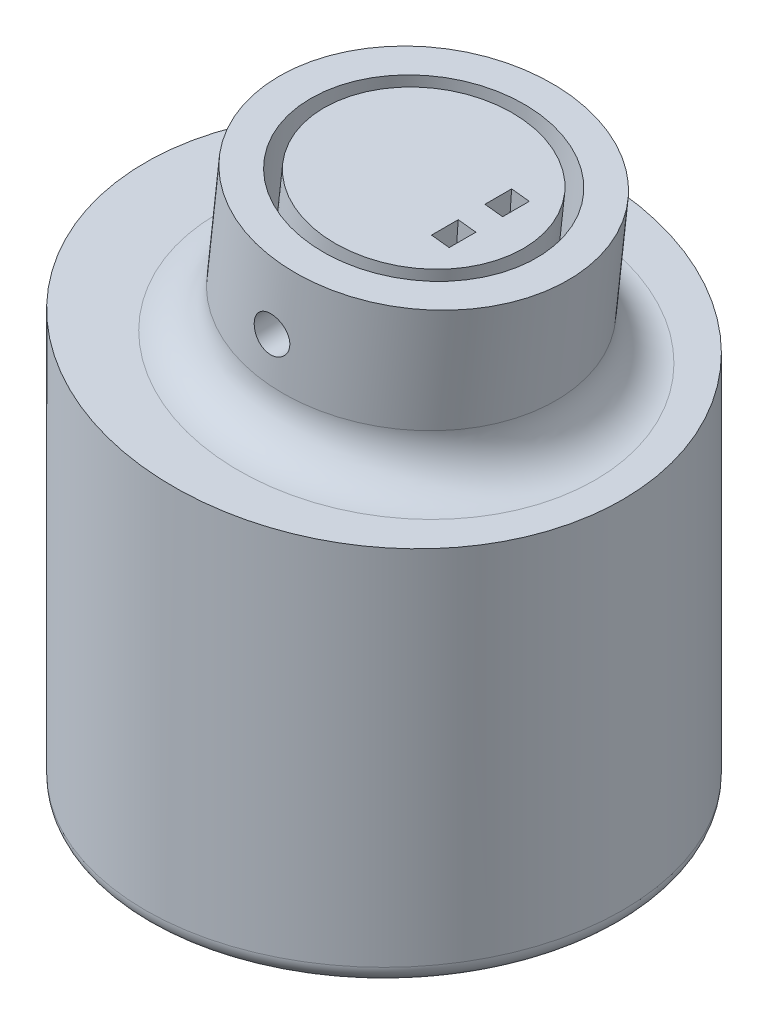
from build123d import *

# Parameters (mm, degrees)
SKETCH1_R                  = 26.8
MAIN_BODY_EXTRUDE_DEPTH    = 41.945
ANGLED_EXTRUDE_OUTLINE_R   = 26.8
ANGLED_EXTRUDE_DEPTH       = 6.012203303
ANGLED_START               = 44.670962752
ANGLED_EXTRUDE_2_OUTLINE_W = 56
ANGLED_EXTRUDE_2_OUTLINE_H = 56
ANGLED_EXTRUDE_2_DEPTH     = 7.329037248
SKETCH8_R                  = 16.325
ATTACHMENT_EXTRUDE_DEPTH   = 22.5
SKETCH11_R                 = 12.7625
SKETCH11_R_2               = 11.2625
TUBING_HOLE_DEPTH          = 45
SKETCH13_R                 = 2
BOLT_HOLE_DEPTH            = 25
SKETCH14_W                 = 34.35
SKETCH14_H                 = 34.35
CUT_EXTRUDE3_DEPTH         = 4
CUT_EXTRUDE4_DEPTH         = 2
SKETCH16_W                 = 23.74
SKETCH16_H                 = 28.35
CUT_EXTRUDE5_DEPTH         = 3.5
CUT_EXTRUDE12_REACH        = 74.294
SKETCH36_W                 = 2
SKETCH36_H                 = 3
FILLET3_R                  = 5
SKETCH32_R                 = 17.343535691
CUT_EXTRUDE10_DEPTH        = 5


with BuildPart() as part:
    # Sketch1 → Main Body Extrude (new body)
    with BuildSketch(Plane(origin=(0, 0, 0), x_dir=(1, 0, 0), z_dir=(0, 1, 0))):
        with Locations(Location((0, 0, 0), (0, 0, 270))):
            Circle(SKETCH1_R)
    extrude(amount=MAIN_BODY_EXTRUDE_DEPTH)

    # Angled Extrude: read off the stored shape, not the designer's step
    # Angled Extrude outline → Angled Extrude (add)
    with BuildSketch(Plane(origin=(0, 41.945, 0), x_dir=(1, 0, 0), z_dir=(0, 1, 0))):
        Circle(ANGLED_EXTRUDE_OUTLINE_R)
    extrude(amount=ANGLED_EXTRUDE_DEPTH)

    # Angled Extrude 2 outline → Angled Extrude 2 (cut)
    with BuildSketch(Plane(origin=(0, 0, 0), x_dir=(0.9937679191605965, -0.11146893220632507, 0), z_dir=(0.11146893220632506, 0.9937679191605965, 0)).offset(ANGLED_START)):
        with Locations((-5, 0)):
            Rectangle(ANGLED_EXTRUDE_2_OUTLINE_W, ANGLED_EXTRUDE_2_OUTLINE_H)
    extrude(amount=ANGLED_EXTRUDE_2_DEPTH, mode=Mode.SUBTRACT)

    # Sketch8 → Attachment Extrude (add)
    with BuildSketch(Plane(origin=(4.979424519, 44.392569701, 0), x_dir=(0.9937679191605964, -0.11146893220632542, 0), z_dir=(0.11146893220632542, 0.9937679191605964, 0))):
        with Locations(Location((-2.486871931, 0, 0), (0, 0, 180))):
            Circle(SKETCH8_R)
    extrude(amount=ATTACHMENT_EXTRUDE_DEPTH)

    # Sketch11 → Tubing Hole (cut)
    with BuildSketch(Plane(origin=(7.487475493, 66.752347882, 0), x_dir=(0.9937679191605964, -0.11146893220632542, 0), z_dir=(0.11146893220632542, 0.9937679191605964, 0))):
        with Locations(Location((-2.486871931, 0, 0), (0, 0, 180))):
            Circle(SKETCH11_R)
        with Locations(Location((-2.486871931, 0, 0), (0, 0, 180))):
            Circle(SKETCH11_R_2, mode=Mode.SUBTRACT)
    extrude(amount=-TUBING_HOLE_DEPTH, mode=Mode.SUBTRACT)

    # Sketch13 → Bolt Hole (cut, symmetric)
    with BuildSketch(Plane.XY):
        with Locations((3.622740297, 54.607457852)):
            Circle(SKETCH13_R)
    extrude(amount=BOLT_HOLE_DEPTH, both=True, mode=Mode.SUBTRACT)

    # Sketch14 → Cut-Extrude3 (cut)
    with BuildSketch(Plane.XZ):
        Rectangle(SKETCH14_W, SKETCH14_H)
    extrude(amount=-CUT_EXTRUDE3_DEPTH, mode=Mode.SUBTRACT)

    # Sketch15 → Cut-Extrude4 (cut)
    with BuildSketch(Plane.XZ.offset(-4)):
        with BuildLine():
            ThreePointArc((-6.675, -12.175), (-5.175, -13.675), (-3.675, -12.175))
            Line((-3.675, -12.175), (-6.675, -12.175))
        make_face()
        with BuildLine():
            Line((-6.675, -12.175), (-3.675, -12.175))
            ThreePointArc((-3.675, -12.175), (-5.175, -10.675), (-6.675, -12.175))
        make_face()
        with BuildLine():
            ThreePointArc((-10.675, 0), (-11.114339828, 1.060660172), (-12.175, 1.5))
            Line((-12.175, 1.5), (-12.175, -1.5))
            ThreePointArc((-12.175, -1.5), (-11.114339828, -1.060660172), (-10.675, 0))
        make_face()
        with BuildLine():
            Line((-12.175, -1.5), (-12.175, 1.5))
            ThreePointArc((-12.175, 1.5), (-13.675, 0), (-12.175, -1.5))
        make_face()
        with BuildLine():
            ThreePointArc((-6.675, 12.175), (-5.175, 10.675), (-3.675, 12.175))
            Line((-3.675, 12.175), (-6.675, 12.175))
        make_face()
        with BuildLine():
            Line((-6.675, 12.175), (-3.675, 12.175))
            ThreePointArc((-3.675, 12.175), (-5.175, 13.675), (-6.675, 12.175))
        make_face()
    extrude(amount=-CUT_EXTRUDE4_DEPTH, mode=Mode.SUBTRACT)

    # Sketch16 → Cut-Extrude5 (cut)
    with BuildSketch(Plane.XZ.offset(-4)):
        with Locations((-2.305, 0)):
            Rectangle(SKETCH16_W, SKETCH16_H)
    extrude(amount=-CUT_EXTRUDE5_DEPTH, mode=Mode.SUBTRACT)

    # Fillet1: read off the stored shape, not the designer's step
    # Fillet1 outline → Fillet1 (revolve, cut)
    with BuildSketch(Plane.XY):
        with BuildLine():
            ThreePointArc((26.8, 2), (26.214213562, 0.585786438), (24.8, 0))
            Line((24.8, 0), (26.8, 0))
            Line((26.8, 0), (26.8, 2))
        make_face()
    revolve(axis=Axis((0, 0, 0), (0, 1, 0)), mode=Mode.SUBTRACT)

    # Cut-Extrude12: up to this plane
    cut_extrude12_end = Plane(origin=(5.016101949, 67.029556841, 0), z_dir=(0.11146893220632542, 0.9937679191605964, 0))
    # Sketch36 → Cut-Extrude12 (cut, up to the surface)
    with BuildSketch(Plane.XZ.offset(-7.5), mode=Mode.PRIVATE) as cut_extrude12_sk1:
        with Locations((7.065, 3)):
            Rectangle(SKETCH36_W, SKETCH36_H)
    cut_extrude12_tool1 = split(extrude(cut_extrude12_sk1.sketch, amount=CUT_EXTRUDE12_REACH, dir=(0.069756473744, 0.99756405026, 0), mode=Mode.PRIVATE), bisect_by=cut_extrude12_end, keep=Keep.BOTH, mode=Mode.PRIVATE)
    add(cut_extrude12_tool1.solids().sort_by_distance((7.065, 7.5, 3))[0], mode=Mode.SUBTRACT)
    # Sketch36 → Cut-Extrude12 (cut, up to the surface)
    with BuildSketch(Plane.XZ.offset(-7.5), mode=Mode.PRIVATE) as cut_extrude12_sk2:
        with Locations((7.065, -3)):
            Rectangle(SKETCH36_W, SKETCH36_H)
    cut_extrude12_tool2 = split(extrude(cut_extrude12_sk2.sketch, amount=CUT_EXTRUDE12_REACH, dir=(0.069756473744, 0.99756405026, 0), mode=Mode.PRIVATE), bisect_by=cut_extrude12_end, keep=Keep.BOTH, mode=Mode.PRIVATE)
    add(cut_extrude12_tool2.solids().sort_by_distance((7.065, 7.5, -3))[0], mode=Mode.SUBTRACT)

    # Fillet3
    fillet3_edges = [part.edges().sort_by_distance(p)[0] for p in [
        (18.731312255, 42.850048342, 0),
    ]]
    fillet(fillet3_edges, radius=FILLET3_R)

    # Sketch32 → Cut-Extrude10 (cut)
    with BuildSketch(Plane(origin=(7.487475493, 66.752347882, 0), x_dir=(0.9937679191605965, -0.11146893220632544, 0), z_dir=(0.11146893220632544, 0.9937679191605965, 0))):
        with Locations((-2.464764356, 0)):
            Circle(SKETCH32_R)
    extrude(amount=-CUT_EXTRUDE10_DEPTH, mode=Mode.SUBTRACT)


solid = part.part
